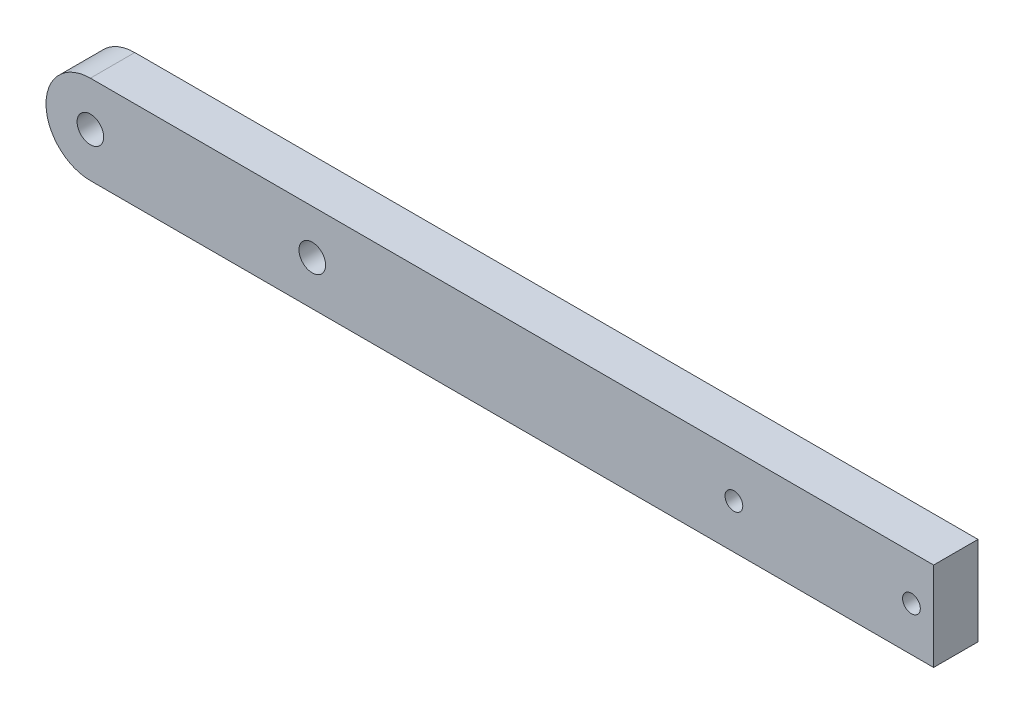
from build123d import *

# Parameters (mm, degrees)
SKETCH1_W           = 200
SKETCH1_H           = 20
SKETCH1_R           = 3
SKETCH1_R_2         = 2
BOSS_EXTRUDE1_DEPTH = 10
FILLET1_R           = 10


with BuildPart() as part:
    # Sketch1 → Boss-Extrude1 (new body)
    with BuildSketch(Plane.XY):
        Rectangle(SKETCH1_W, SKETCH1_H)
        with Locations((-90, 0)):
            Circle(SKETCH1_R, mode=Mode.SUBTRACT)
        with Locations((-40, 0)):
            Circle(SKETCH1_R, mode=Mode.SUBTRACT)
        with Locations((95, 0)):
            Circle(SKETCH1_R_2, mode=Mode.SUBTRACT)
        with Locations((55, 0)):
            Circle(SKETCH1_R_2, mode=Mode.SUBTRACT)
    extrude(amount=BOSS_EXTRUDE1_DEPTH)

    # Fillet1
    fillet1_edges = [part.edges().sort_by_distance(p)[0] for p in [
        (-100, -10, 5),
        (-100, 10, 5),
    ]]
    fillet(fillet1_edges, radius=FILLET1_R - 0.0001)  # a hair under: the kernel refuses the full size


solid = part.part
